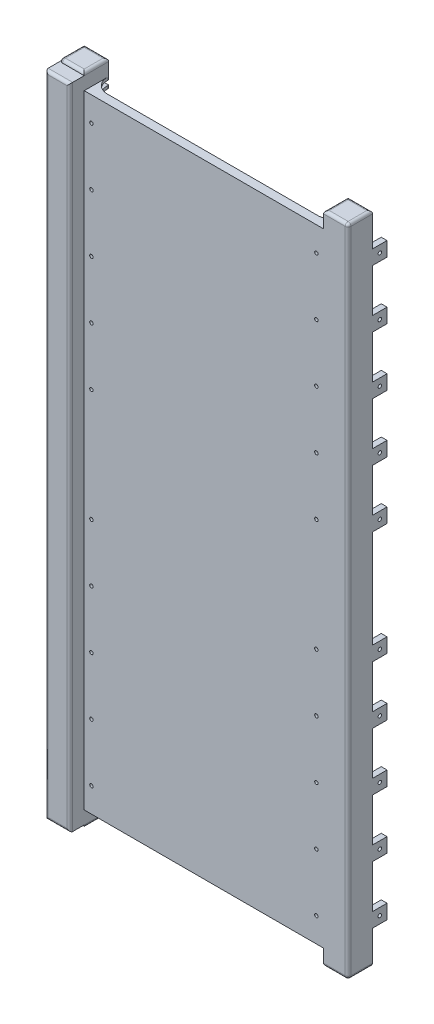
from build123d import *

# Parameters (mm, degrees)
BOSS_EXTRUDE1_DEPTH             = 227
FILLET1_R                       = 1
SKETCH2_W                       = 2
SKETCH2_H                       = 5
BOSS_EXTRUDE2_DEPTH             = 5
BOSS_EXTRUDE6_START             = -41.5
SKETCH13_W                      = 0.2
SKETCH13_H                      = 214
BOSS_EXTRUDE6_DEPTH             = 41.5
F_0_80_TAPPED_HOLE1_AT_2_COUNT  = 2
F_0_80_TAPPED_HOLE1_AT_2_PITCH  = 20
F_0_80_TAPPED_HOLE1_AT_3_COUNT  = 2
F_0_80_TAPPED_HOLE1_AT_3_PITCH  = 40
F_0_80_TAPPED_HOLE1_AT_4_COUNT  = 2
F_0_80_TAPPED_HOLE1_AT_4_PITCH  = 60
F_0_80_TAPPED_HOLE1_AT_5_COUNT  = 2
F_0_80_TAPPED_HOLE1_AT_5_PITCH  = 80
F_0_80_TAPPED_HOLE1_AT_6_COUNT  = 2
F_0_80_TAPPED_HOLE1_AT_6_PITCH  = 119
F_0_80_TAPPED_HOLE1_AT_7_COUNT  = 2
F_0_80_TAPPED_HOLE1_AT_7_PITCH  = 139
F_0_80_TAPPED_HOLE1_AT_8_COUNT  = 2
F_0_80_TAPPED_HOLE1_AT_8_PITCH  = 159
F_0_80_TAPPED_HOLE1_AT_9_COUNT  = 2
F_0_80_TAPPED_HOLE1_AT_9_PITCH  = 179
F_0_80_TAPPED_HOLE1_AT_10_COUNT = 2
F_0_80_TAPPED_HOLE1_AT_10_PITCH = 199
FILLET2_R                       = 2.5
CUT_EXTRUDE1_START              = -6.5
SKETCH3_W                       = 6.5
SKETCH3_H                       = 6.5
CUT_EXTRUDE1_DEPTH              = 214
MIRROR7_COPY_10_SKETCH_W        = 2
MIRROR7_COPY_10_SKETCH_H        = 5
MIRROR7_COPY_10_DEPTH           = 5
FILLET1_OF_MIRROR7_R            = 1
FILLET2_OF_MIRROR7_R            = 2.5
SKETCH14_W                      = 8.5
SKETCH14_H                      = 1
BOSS_EXTRUDE7_DEPTH             = 96
CUT_EXTRUDE2_DEPTH              = 242.486800882
BOSS_EXTRUDE8_DEPTH             = 5
BOSS_EXTRUDE8_DEPTH_BACK        = 1
SKETCH17_W                      = 8.5
SKETCH17_H                      = 225
SKETCH16_W                      = 15
SKETCH16_H                      = 1.55
CUT_EXTRUDE3_DEPTH              = 245.922053927
FILLET3_R                       = 1


with BuildPart() as part:
    # Sketch1 → Boss-Extrude1 (new body)
    with BuildSketch(Plane(origin=(0, 0, 0), x_dir=(1, 0, 0), z_dir=(0, 1, 0))):
        with BuildLine():
            Line((-3.25, -4.25), (4.25, -4.25))
            Line((4.25, -4.25), (4.25, 4.25))
            Line((4.25, 4.25), (-4.25, 4.25))
            Line((-4.25, 4.25), (-4.25, -3.25))
            ThreePointArc((-4.25, -3.25), (-3.957106781, -3.957106781), (-3.25, -4.25))
        make_face()
    boss_extrude1 = extrude(amount=BOSS_EXTRUDE1_DEPTH)

    # Fillet1
    fillet1_edges = [part.edges().sort_by_distance(p)[0] for p in [
        (-4.25, 227, -0.5),
        (-3.957106781, 227, 3.957106781),
        (0.5, 227, 4.25),
        (4.25, 227, 0),
        (0.5, 0, 4.25),
        (-3.957106781, 0, 3.957106781),
        (-4.25, 0, -0.5),
        (0, 0, -4.25),
        (4.25, 0, 0),
        (0, 227, -4.25),
    ]]
    fillet(fillet1_edges, radius=FILLET1_R)

    # Sketch2 → Boss-Extrude2 (add)
    with BuildSketch(Plane(origin=(4.25, 0, 0), x_dir=(0, 0, -1), z_dir=(1, 0, 0))):
        with Locations((-3.25, 213)):
            Rectangle(SKETCH2_W, SKETCH2_H)
        with Locations((-3.25, 193)):
            Rectangle(SKETCH2_W, SKETCH2_H)
        with Locations((-3.25, 173)):
            Rectangle(SKETCH2_W, SKETCH2_H)
        with Locations((-3.25, 153)):
            Rectangle(SKETCH2_W, SKETCH2_H)
        with Locations((-3.25, 133)):
            Rectangle(SKETCH2_W, SKETCH2_H)
        with Locations((-3.25, 94)):
            Rectangle(SKETCH2_W, SKETCH2_H)
        with Locations((-3.25, 74)):
            Rectangle(SKETCH2_W, SKETCH2_H)
        with Locations((-3.25, 54)):
            Rectangle(SKETCH2_W, SKETCH2_H)
        with Locations((-3.25, 34)):
            Rectangle(SKETCH2_W, SKETCH2_H)
        with Locations((-3.25, 14)):
            Rectangle(SKETCH2_W, SKETCH2_H)
    boss_extrude2 = extrude(amount=BOSS_EXTRUDE2_DEPTH)

    # Sketch13 → Boss-Extrude6 (add)
    with BuildSketch(Plane.ZY.offset(-4.25).offset(BOSS_EXTRUDE6_START)):
        with Locations((4.15, 113.5)):
            Rectangle(SKETCH13_W, SKETCH13_H)
    boss_extrude6 = extrude(amount=BOSS_EXTRUDE6_DEPTH)

    # Sketch11 → #0-80 Tapped Hole1 (revolve, cut)
    with BuildSketch(Plane(origin=(6.75, 213, 4.25), x_dir=(0, -1, 0), z_dir=(1, 0, 0))):
        Polygon((0, 0), (0, 4.358390611), (0.59563, 4.0005), (0.59563, 0), align=None)
    f_0_80_tapped_hole1 = revolve(axis=Axis((6.75, 213, 10.6), (0, 0, -1)), mode=Mode.SUBTRACT)

    # #0-80 Tapped Hole1 at 2: #0-80 Tapped Hole1 ×2
    with Locations(*[(0, -i * F_0_80_TAPPED_HOLE1_AT_2_PITCH, 0) for i in range(1, F_0_80_TAPPED_HOLE1_AT_2_COUNT)]):
        add(f_0_80_tapped_hole1, mode=Mode.SUBTRACT)

    # #0-80 Tapped Hole1 at 3: #0-80 Tapped Hole1 ×2
    with Locations(*[(0, -i * F_0_80_TAPPED_HOLE1_AT_3_PITCH, 0) for i in range(1, F_0_80_TAPPED_HOLE1_AT_3_COUNT)]):
        add(f_0_80_tapped_hole1, mode=Mode.SUBTRACT)

    # #0-80 Tapped Hole1 at 4: #0-80 Tapped Hole1 ×2
    with Locations(*[(0, -i * F_0_80_TAPPED_HOLE1_AT_4_PITCH, 0) for i in range(1, F_0_80_TAPPED_HOLE1_AT_4_COUNT)]):
        add(f_0_80_tapped_hole1, mode=Mode.SUBTRACT)

    # #0-80 Tapped Hole1 at 5: #0-80 Tapped Hole1 ×2
    with Locations(*[(0, -i * F_0_80_TAPPED_HOLE1_AT_5_PITCH, 0) for i in range(1, F_0_80_TAPPED_HOLE1_AT_5_COUNT)]):
        add(f_0_80_tapped_hole1, mode=Mode.SUBTRACT)

    # #0-80 Tapped Hole1 at 6: #0-80 Tapped Hole1 ×2
    with Locations(*[(0, -i * F_0_80_TAPPED_HOLE1_AT_6_PITCH, 0) for i in range(1, F_0_80_TAPPED_HOLE1_AT_6_COUNT)]):
        add(f_0_80_tapped_hole1, mode=Mode.SUBTRACT)

    # #0-80 Tapped Hole1 at 7: #0-80 Tapped Hole1 ×2
    with Locations(*[(0, -i * F_0_80_TAPPED_HOLE1_AT_7_PITCH, 0) for i in range(1, F_0_80_TAPPED_HOLE1_AT_7_COUNT)]):
        add(f_0_80_tapped_hole1, mode=Mode.SUBTRACT)

    # #0-80 Tapped Hole1 at 8: #0-80 Tapped Hole1 ×2
    with Locations(*[(0, -i * F_0_80_TAPPED_HOLE1_AT_8_PITCH, 0) for i in range(1, F_0_80_TAPPED_HOLE1_AT_8_COUNT)]):
        add(f_0_80_tapped_hole1, mode=Mode.SUBTRACT)

    # #0-80 Tapped Hole1 at 9: #0-80 Tapped Hole1 ×2
    with Locations(*[(0, -i * F_0_80_TAPPED_HOLE1_AT_9_PITCH, 0) for i in range(1, F_0_80_TAPPED_HOLE1_AT_9_COUNT)]):
        add(f_0_80_tapped_hole1, mode=Mode.SUBTRACT)

    # #0-80 Tapped Hole1 at 10: #0-80 Tapped Hole1 ×2
    with Locations(*[(0, -i * F_0_80_TAPPED_HOLE1_AT_10_PITCH, 0) for i in range(1, F_0_80_TAPPED_HOLE1_AT_10_COUNT)]):
        add(f_0_80_tapped_hole1, mode=Mode.SUBTRACT)

    # Fillet2
    fillet2_edges = [part.edges().sort_by_distance(p)[0] for p in [
        (4.25, 215.5, 3.15),
    ]]
    fillet(fillet2_edges, radius=FILLET2_R)
    fillet2_2_edges = [part.edges().sort_by_distance(p)[0] for p in [
        (4.25, 195.5, 3.15),
    ]]
    fillet(fillet2_2_edges, radius=FILLET2_R)
    fillet2_3_edges = [part.edges().sort_by_distance(p)[0] for p in [
        (4.25, 175.5, 3.15),
    ]]
    fillet(fillet2_3_edges, radius=FILLET2_R)
    fillet2_4_edges = [part.edges().sort_by_distance(p)[0] for p in [
        (4.25, 155.5, 3.15),
    ]]
    fillet(fillet2_4_edges, radius=FILLET2_R)
    fillet2_5_edges = [part.edges().sort_by_distance(p)[0] for p in [
        (4.25, 135.5, 3.15),
    ]]
    fillet(fillet2_5_edges, radius=FILLET2_R)
    fillet2_6_edges = [part.edges().sort_by_distance(p)[0] for p in [
        (4.25, 91.5, 3.15),
    ]]
    fillet(fillet2_6_edges, radius=FILLET2_R)
    fillet2_7_edges = [part.edges().sort_by_distance(p)[0] for p in [
        (4.25, 71.5, 3.15),
    ]]
    fillet(fillet2_7_edges, radius=FILLET2_R)
    fillet2_8_edges = [part.edges().sort_by_distance(p)[0] for p in [
        (4.25, 51.5, 3.15),
    ]]
    fillet(fillet2_8_edges, radius=FILLET2_R)
    fillet2_9_edges = [part.edges().sort_by_distance(p)[0] for p in [
        (4.25, 31.5, 3.15),
    ]]
    fillet(fillet2_9_edges, radius=FILLET2_R)
    fillet2_10_edges = [part.edges().sort_by_distance(p)[0] for p in [
        (4.25, 11.5, 3.15),
    ]]
    fillet(fillet2_10_edges, radius=FILLET2_R)
    fillet2_11_edges = [part.edges().sort_by_distance(p)[0] for p in [
        (9.25, 215.5, 3.15),
    ]]
    fillet(fillet2_11_edges, radius=FILLET2_R - 0.0001)  # a hair under: the kernel refuses the full size
    fillet2_12_edges = [part.edges().sort_by_distance(p)[0] for p in [
        (9.25, 195.5, 3.15),
    ]]
    fillet(fillet2_12_edges, radius=FILLET2_R - 0.0001)  # a hair under: the kernel refuses the full size
    fillet2_13_edges = [part.edges().sort_by_distance(p)[0] for p in [
        (9.25, 175.5, 3.15),
    ]]
    fillet(fillet2_13_edges, radius=FILLET2_R - 0.0001)  # a hair under: the kernel refuses the full size
    fillet2_14_edges = [part.edges().sort_by_distance(p)[0] for p in [
        (9.25, 155.5, 3.15),
    ]]
    fillet(fillet2_14_edges, radius=FILLET2_R - 0.0001)  # a hair under: the kernel refuses the full size
    fillet2_15_edges = [part.edges().sort_by_distance(p)[0] for p in [
        (9.25, 135.5, 3.15),
    ]]
    fillet(fillet2_15_edges, radius=FILLET2_R - 0.0001)  # a hair under: the kernel refuses the full size
    fillet2_16_edges = [part.edges().sort_by_distance(p)[0] for p in [
        (9.25, 91.5, 3.15),
    ]]
    fillet(fillet2_16_edges, radius=FILLET2_R - 0.0001)  # a hair under: the kernel refuses the full size
    fillet2_17_edges = [part.edges().sort_by_distance(p)[0] for p in [
        (9.25, 71.5, 3.15),
    ]]
    fillet(fillet2_17_edges, radius=FILLET2_R - 0.0001)  # a hair under: the kernel refuses the full size
    fillet2_18_edges = [part.edges().sort_by_distance(p)[0] for p in [
        (9.25, 51.5, 3.15),
    ]]
    fillet(fillet2_18_edges, radius=FILLET2_R - 0.0001)  # a hair under: the kernel refuses the full size
    fillet2_19_edges = [part.edges().sort_by_distance(p)[0] for p in [
        (9.25, 31.5, 3.15),
    ]]
    fillet(fillet2_19_edges, radius=FILLET2_R - 0.0001)  # a hair under: the kernel refuses the full size
    fillet2_20_edges = [part.edges().sort_by_distance(p)[0] for p in [
        (9.25, 11.5, 3.15),
    ]]
    fillet(fillet2_20_edges, radius=FILLET2_R - 0.0001)  # a hair under: the kernel refuses the full size

    # Mirror1: Boss-Extrude2, #0-80 Tapped Hole1 across plane
    add(boss_extrude2.mirror(Plane(origin=(0, 0, 0), x_dir=(-0.7071067811865478, 0, 0.7071067811865472), z_dir=(-0.7071067811865475, 0, -0.7071067811865477))))
    add(f_0_80_tapped_hole1.mirror(Plane(origin=(0, 0, 0), x_dir=(-0.7071067811865478, 0, 0.7071067811865472), z_dir=(-0.7071067811865475, 0, -0.7071067811865477))), mode=Mode.SUBTRACT)

    # Mirror1 copy 1 sketch → Mirror1 copy 1 (revolve, cut)
    with BuildSketch(Plane(origin=(-4.25, 193, -6.75), x_dir=(0, -1, 0), z_dir=(0, 0, -1))):
        Polygon((0, 0), (0, -4.358390611), (0.59563, -4.0005), (0.59563, 0), align=None)
    revolve(axis=Axis((-10.6, 193, -6.75), (-1, 0, 0)), mode=Mode.SUBTRACT)

    # Mirror1 copy 2 sketch → Mirror1 copy 2 (revolve, cut)
    with BuildSketch(Plane(origin=(-4.25, 173, -6.75), x_dir=(0, -1, 0), z_dir=(0, 0, -1))):
        Polygon((0, 0), (0, -4.358390611), (0.59563, -4.0005), (0.59563, 0), align=None)
    revolve(axis=Axis((-10.6, 173, -6.75), (-1, 0, 0)), mode=Mode.SUBTRACT)

    # Mirror1 copy 3 sketch → Mirror1 copy 3 (revolve, cut)
    with BuildSketch(Plane(origin=(-4.25, 153, -6.75), x_dir=(0, -1, 0), z_dir=(0, 0, -1))):
        Polygon((0, 0), (0, -4.358390611), (0.59563, -4.0005), (0.59563, 0), align=None)
    revolve(axis=Axis((-10.6, 153, -6.75), (-1, 0, 0)), mode=Mode.SUBTRACT)

    # Mirror1 copy 4 sketch → Mirror1 copy 4 (revolve, cut)
    with BuildSketch(Plane(origin=(-4.25, 133, -6.75), x_dir=(0, -1, 0), z_dir=(0, 0, -1))):
        Polygon((0, 0), (0, -4.358390611), (0.59563, -4.0005), (0.59563, 0), align=None)
    revolve(axis=Axis((-10.6, 133, -6.75), (-1, 0, 0)), mode=Mode.SUBTRACT)

    # Mirror1 copy 5 sketch → Mirror1 copy 5 (revolve, cut)
    with BuildSketch(Plane(origin=(-4.25, 94, -6.75), x_dir=(0, -1, 0), z_dir=(0, 0, -1))):
        Polygon((0, 0), (0, -4.358390611), (0.59563, -4.0005), (0.59563, 0), align=None)
    revolve(axis=Axis((-10.6, 94, -6.75), (-1, 0, 0)), mode=Mode.SUBTRACT)

    # Mirror1 copy 6 sketch → Mirror1 copy 6 (revolve, cut)
    with BuildSketch(Plane(origin=(-4.25, 74, -6.75), x_dir=(0, -1, 0), z_dir=(0, 0, -1))):
        Polygon((0, 0), (0, -4.358390611), (0.59563, -4.0005), (0.59563, 0), align=None)
    revolve(axis=Axis((-10.6, 74, -6.75), (-1, 0, 0)), mode=Mode.SUBTRACT)

    # Mirror1 copy 7 sketch → Mirror1 copy 7 (revolve, cut)
    with BuildSketch(Plane(origin=(-4.25, 54, -6.75), x_dir=(0, -1, 0), z_dir=(0, 0, -1))):
        Polygon((0, 0), (0, -4.358390611), (0.59563, -4.0005), (0.59563, 0), align=None)
    revolve(axis=Axis((-10.6, 54, -6.75), (-1, 0, 0)), mode=Mode.SUBTRACT)

    # Mirror1 copy 8 sketch → Mirror1 copy 8 (revolve, cut)
    with BuildSketch(Plane(origin=(-4.25, 34, -6.75), x_dir=(0, -1, 0), z_dir=(0, 0, -1))):
        Polygon((0, 0), (0, -4.358390611), (0.59563, -4.0005), (0.59563, 0), align=None)
    revolve(axis=Axis((-10.6, 34, -6.75), (-1, 0, 0)), mode=Mode.SUBTRACT)

    # Mirror1 copy 9 sketch → Mirror1 copy 9 (revolve, cut)
    with BuildSketch(Plane(origin=(-4.25, 14, -6.75), x_dir=(0, -1, 0), z_dir=(0, 0, -1))):
        Polygon((0, 0), (0, -4.358390611), (0.59563, -4.0005), (0.59563, 0), align=None)
    revolve(axis=Axis((-10.6, 14, -6.75), (-1, 0, 0)), mode=Mode.SUBTRACT)

    # Sketch3 → Cut-Extrude1 (cut)
    with BuildSketch(Plane(origin=(0, 227, 0), x_dir=(1, 0, 0), z_dir=(0, 1, 0)).offset(CUT_EXTRUDE1_START)):
        with Locations((1, 1)):
            Rectangle(SKETCH3_W, SKETCH3_H)
    cut_extrude1 = extrude(amount=-CUT_EXTRUDE1_DEPTH, mode=Mode.SUBTRACT)

    # Mirror7: Boss-Extrude1, Boss-Extrude2, Boss-Extrude6, #0-80 Tapped Hole1, Cut-Extrude1 across plane
    add(boss_extrude1.mirror(Plane.ZY.offset(-45.75)))
    add(boss_extrude2.mirror(Plane.ZY.offset(-45.75)))
    add(boss_extrude6.mirror(Plane.ZY.offset(-45.75)))
    add(f_0_80_tapped_hole1.mirror(Plane.ZY.offset(-45.75)), mode=Mode.SUBTRACT)
    add(cut_extrude1.mirror(Plane.ZY.offset(-45.75)), mode=Mode.SUBTRACT)

    # Mirror7 copy 1 sketch → Mirror7 copy 1 (revolve, cut)
    with BuildSketch(Plane(origin=(84.75, 193, 4.25), x_dir=(0, -1, 0), z_dir=(-1, 0, 0))):
        Polygon((0, 0), (0, -4.358390611), (0.59563, -4.0005), (0.59563, 0), align=None)
    revolve(axis=Axis((84.75, 193, 10.6), (0, 0, 1)), mode=Mode.SUBTRACT)

    # Mirror7 copy 2 sketch → Mirror7 copy 2 (revolve, cut)
    with BuildSketch(Plane(origin=(84.75, 173, 4.25), x_dir=(0, -1, 0), z_dir=(-1, 0, 0))):
        Polygon((0, 0), (0, -4.358390611), (0.59563, -4.0005), (0.59563, 0), align=None)
    revolve(axis=Axis((84.75, 173, 10.6), (0, 0, 1)), mode=Mode.SUBTRACT)

    # Mirror7 copy 3 sketch → Mirror7 copy 3 (revolve, cut)
    with BuildSketch(Plane(origin=(84.75, 153, 4.25), x_dir=(0, -1, 0), z_dir=(-1, 0, 0))):
        Polygon((0, 0), (0, -4.358390611), (0.59563, -4.0005), (0.59563, 0), align=None)
    revolve(axis=Axis((84.75, 153, 10.6), (0, 0, 1)), mode=Mode.SUBTRACT)

    # Mirror7 copy 4 sketch → Mirror7 copy 4 (revolve, cut)
    with BuildSketch(Plane(origin=(84.75, 133, 4.25), x_dir=(0, -1, 0), z_dir=(-1, 0, 0))):
        Polygon((0, 0), (0, -4.358390611), (0.59563, -4.0005), (0.59563, 0), align=None)
    revolve(axis=Axis((84.75, 133, 10.6), (0, 0, 1)), mode=Mode.SUBTRACT)

    # Mirror7 copy 5 sketch → Mirror7 copy 5 (revolve, cut)
    with BuildSketch(Plane(origin=(84.75, 94, 4.25), x_dir=(0, -1, 0), z_dir=(-1, 0, 0))):
        Polygon((0, 0), (0, -4.358390611), (0.59563, -4.0005), (0.59563, 0), align=None)
    revolve(axis=Axis((84.75, 94, 10.6), (0, 0, 1)), mode=Mode.SUBTRACT)

    # Mirror7 copy 6 sketch → Mirror7 copy 6 (revolve, cut)
    with BuildSketch(Plane(origin=(84.75, 74, 4.25), x_dir=(0, -1, 0), z_dir=(-1, 0, 0))):
        Polygon((0, 0), (0, -4.358390611), (0.59563, -4.0005), (0.59563, 0), align=None)
    revolve(axis=Axis((84.75, 74, 10.6), (0, 0, 1)), mode=Mode.SUBTRACT)

    # Mirror7 copy 7 sketch → Mirror7 copy 7 (revolve, cut)
    with BuildSketch(Plane(origin=(84.75, 54, 4.25), x_dir=(0, -1, 0), z_dir=(-1, 0, 0))):
        Polygon((0, 0), (0, -4.358390611), (0.59563, -4.0005), (0.59563, 0), align=None)
    revolve(axis=Axis((84.75, 54, 10.6), (0, 0, 1)), mode=Mode.SUBTRACT)

    # Mirror7 copy 8 sketch → Mirror7 copy 8 (revolve, cut)
    with BuildSketch(Plane(origin=(84.75, 34, 4.25), x_dir=(0, -1, 0), z_dir=(-1, 0, 0))):
        Polygon((0, 0), (0, -4.358390611), (0.59563, -4.0005), (0.59563, 0), align=None)
    revolve(axis=Axis((84.75, 34, 10.6), (0, 0, 1)), mode=Mode.SUBTRACT)

    # Mirror7 copy 9 sketch → Mirror7 copy 9 (revolve, cut)
    with BuildSketch(Plane(origin=(84.75, 14, 4.25), x_dir=(0, -1, 0), z_dir=(-1, 0, 0))):
        Polygon((0, 0), (0, -4.358390611), (0.59563, -4.0005), (0.59563, 0), align=None)
    revolve(axis=Axis((84.75, 14, 10.6), (0, 0, 1)), mode=Mode.SUBTRACT)

    # Mirror7 copy 10 sketch → Mirror7 copy 10 (add)
    with BuildSketch(Plane(origin=(91.5, 0, -4.25), x_dir=(-1, 0, 0), z_dir=(0, 0, -1))):
        with Locations((-3.25, 213)):
            Rectangle(MIRROR7_COPY_10_SKETCH_W, MIRROR7_COPY_10_SKETCH_H)
        with Locations((-3.25, 193)):
            Rectangle(MIRROR7_COPY_10_SKETCH_W, MIRROR7_COPY_10_SKETCH_H)
        with Locations((-3.25, 173)):
            Rectangle(MIRROR7_COPY_10_SKETCH_W, MIRROR7_COPY_10_SKETCH_H)
        with Locations((-3.25, 153)):
            Rectangle(MIRROR7_COPY_10_SKETCH_W, MIRROR7_COPY_10_SKETCH_H)
        with Locations((-3.25, 133)):
            Rectangle(MIRROR7_COPY_10_SKETCH_W, MIRROR7_COPY_10_SKETCH_H)
        with Locations((-3.25, 94)):
            Rectangle(MIRROR7_COPY_10_SKETCH_W, MIRROR7_COPY_10_SKETCH_H)
        with Locations((-3.25, 74)):
            Rectangle(MIRROR7_COPY_10_SKETCH_W, MIRROR7_COPY_10_SKETCH_H)
        with Locations((-3.25, 54)):
            Rectangle(MIRROR7_COPY_10_SKETCH_W, MIRROR7_COPY_10_SKETCH_H)
        with Locations((-3.25, 34)):
            Rectangle(MIRROR7_COPY_10_SKETCH_W, MIRROR7_COPY_10_SKETCH_H)
        with Locations((-3.25, 14)):
            Rectangle(MIRROR7_COPY_10_SKETCH_W, MIRROR7_COPY_10_SKETCH_H)
    extrude(amount=MIRROR7_COPY_10_DEPTH)

    # Mirror7 copy 11 sketch → Mirror7 copy 11 (revolve, cut)
    with BuildSketch(Plane(origin=(95.75, 213, -6.75), x_dir=(0, -1, 0), z_dir=(0, 0, -1))):
        Polygon((0, 0), (0, 4.358390611), (0.59563, 4.0005), (0.59563, 0), align=None)
    revolve(axis=Axis((102.1, 213, -6.75), (-1, 0, 0)), mode=Mode.SUBTRACT)

    # Mirror7 copy 12 sketch → Mirror7 copy 12 (revolve, cut)
    with BuildSketch(Plane(origin=(95.75, 193, -6.75), x_dir=(0, -1, 0), z_dir=(0, 0, -1))):
        Polygon((0, 0), (0, 4.358390611), (0.59563, 4.0005), (0.59563, 0), align=None)
    revolve(axis=Axis((102.1, 193, -6.75), (-1, 0, 0)), mode=Mode.SUBTRACT)

    # Mirror7 copy 13 sketch → Mirror7 copy 13 (revolve, cut)
    with BuildSketch(Plane(origin=(95.75, 173, -6.75), x_dir=(0, -1, 0), z_dir=(0, 0, -1))):
        Polygon((0, 0), (0, 4.358390611), (0.59563, 4.0005), (0.59563, 0), align=None)
    revolve(axis=Axis((102.1, 173, -6.75), (-1, 0, 0)), mode=Mode.SUBTRACT)

    # Mirror7 copy 14 sketch → Mirror7 copy 14 (revolve, cut)
    with BuildSketch(Plane(origin=(95.75, 153, -6.75), x_dir=(0, -1, 0), z_dir=(0, 0, -1))):
        Polygon((0, 0), (0, 4.358390611), (0.59563, 4.0005), (0.59563, 0), align=None)
    revolve(axis=Axis((102.1, 153, -6.75), (-1, 0, 0)), mode=Mode.SUBTRACT)

    # Mirror7 copy 15 sketch → Mirror7 copy 15 (revolve, cut)
    with BuildSketch(Plane(origin=(95.75, 133, -6.75), x_dir=(0, -1, 0), z_dir=(0, 0, -1))):
        Polygon((0, 0), (0, 4.358390611), (0.59563, 4.0005), (0.59563, 0), align=None)
    revolve(axis=Axis((102.1, 133, -6.75), (-1, 0, 0)), mode=Mode.SUBTRACT)

    # Mirror7 copy 16 sketch → Mirror7 copy 16 (revolve, cut)
    with BuildSketch(Plane(origin=(95.75, 94, -6.75), x_dir=(0, -1, 0), z_dir=(0, 0, -1))):
        Polygon((0, 0), (0, 4.358390611), (0.59563, 4.0005), (0.59563, 0), align=None)
    revolve(axis=Axis((102.1, 94, -6.75), (-1, 0, 0)), mode=Mode.SUBTRACT)

    # Mirror7 copy 17 sketch → Mirror7 copy 17 (revolve, cut)
    with BuildSketch(Plane(origin=(95.75, 74, -6.75), x_dir=(0, -1, 0), z_dir=(0, 0, -1))):
        Polygon((0, 0), (0, 4.358390611), (0.59563, 4.0005), (0.59563, 0), align=None)
    revolve(axis=Axis((102.1, 74, -6.75), (-1, 0, 0)), mode=Mode.SUBTRACT)

    # Mirror7 copy 18 sketch → Mirror7 copy 18 (revolve, cut)
    with BuildSketch(Plane(origin=(95.75, 54, -6.75), x_dir=(0, -1, 0), z_dir=(0, 0, -1))):
        Polygon((0, 0), (0, 4.358390611), (0.59563, 4.0005), (0.59563, 0), align=None)
    revolve(axis=Axis((102.1, 54, -6.75), (-1, 0, 0)), mode=Mode.SUBTRACT)

    # Mirror7 copy 19 sketch → Mirror7 copy 19 (revolve, cut)
    with BuildSketch(Plane(origin=(95.75, 34, -6.75), x_dir=(0, -1, 0), z_dir=(0, 0, -1))):
        Polygon((0, 0), (0, 4.358390611), (0.59563, 4.0005), (0.59563, 0), align=None)
    revolve(axis=Axis((102.1, 34, -6.75), (-1, 0, 0)), mode=Mode.SUBTRACT)

    # Mirror7 copy 20 sketch → Mirror7 copy 20 (revolve, cut)
    with BuildSketch(Plane(origin=(95.75, 14, -6.75), x_dir=(0, -1, 0), z_dir=(0, 0, -1))):
        Polygon((0, 0), (0, 4.358390611), (0.59563, 4.0005), (0.59563, 0), align=None)
    revolve(axis=Axis((102.1, 14, -6.75), (-1, 0, 0)), mode=Mode.SUBTRACT)

    # Fillet1 of Mirror7
    fillet1_of_mirror7_edges = [part.edges().sort_by_distance(p)[0] for p in [
        (95.75, 227, -0.5),
        (95.457106781, 227, 3.957106781),
        (91, 227, 4.25),
        (87.25, 227, 0),
        (91, 0, 4.25),
        (95.457106781, 0, 3.957106781),
        (95.75, 0, -0.5),
        (91.5, 0, -4.25),
        (87.25, 0, 0),
        (91.5, 227, -4.25),
    ]]
    fillet(fillet1_of_mirror7_edges, radius=FILLET1_OF_MIRROR7_R)

    # Fillet2 of Mirror7
    fillet2_of_mirror7_edges = [part.edges().sort_by_distance(p)[0] for p in [
        (87.25, 11.5, 3.15),
    ]]
    fillet(fillet2_of_mirror7_edges, radius=FILLET2_OF_MIRROR7_R)
    fillet2_of_mirror7_2_edges = [part.edges().sort_by_distance(p)[0] for p in [
        (87.25, 215.5, 3.15),
    ]]
    fillet(fillet2_of_mirror7_2_edges, radius=FILLET2_OF_MIRROR7_R)
    fillet2_of_mirror7_3_edges = [part.edges().sort_by_distance(p)[0] for p in [
        (82.25, 11.5, 3.15),
    ]]
    fillet(fillet2_of_mirror7_3_edges, radius=FILLET2_OF_MIRROR7_R - 0.0001)  # a hair under: the kernel refuses the full size
    fillet2_of_mirror7_4_edges = [part.edges().sort_by_distance(p)[0] for p in [
        (82.25, 215.5, 3.15),
    ]]
    fillet(fillet2_of_mirror7_4_edges, radius=FILLET2_OF_MIRROR7_R - 0.0001)  # a hair under: the kernel refuses the full size
    fillet2_of_mirror7_5_edges = [part.edges().sort_by_distance(p)[0] for p in [
        (87.25, 195.5, 3.15),
    ]]
    fillet(fillet2_of_mirror7_5_edges, radius=FILLET2_OF_MIRROR7_R)
    fillet2_of_mirror7_6_edges = [part.edges().sort_by_distance(p)[0] for p in [
        (87.25, 31.5, 3.15),
    ]]
    fillet(fillet2_of_mirror7_6_edges, radius=FILLET2_OF_MIRROR7_R)
    fillet2_of_mirror7_7_edges = [part.edges().sort_by_distance(p)[0] for p in [
        (82.25, 195.5, 3.15),
    ]]
    fillet(fillet2_of_mirror7_7_edges, radius=FILLET2_OF_MIRROR7_R - 0.0001)  # a hair under: the kernel refuses the full size
    fillet2_of_mirror7_8_edges = [part.edges().sort_by_distance(p)[0] for p in [
        (82.25, 31.5, 3.15),
    ]]
    fillet(fillet2_of_mirror7_8_edges, radius=FILLET2_OF_MIRROR7_R - 0.0001)  # a hair under: the kernel refuses the full size
    fillet2_of_mirror7_9_edges = [part.edges().sort_by_distance(p)[0] for p in [
        (87.25, 175.5, 3.15),
    ]]
    fillet(fillet2_of_mirror7_9_edges, radius=FILLET2_OF_MIRROR7_R)
    fillet2_of_mirror7_10_edges = [part.edges().sort_by_distance(p)[0] for p in [
        (87.25, 51.5, 3.15),
    ]]
    fillet(fillet2_of_mirror7_10_edges, radius=FILLET2_OF_MIRROR7_R)
    fillet2_of_mirror7_11_edges = [part.edges().sort_by_distance(p)[0] for p in [
        (82.25, 175.5, 3.15),
    ]]
    fillet(fillet2_of_mirror7_11_edges, radius=FILLET2_OF_MIRROR7_R - 0.0001)  # a hair under: the kernel refuses the full size
    fillet2_of_mirror7_12_edges = [part.edges().sort_by_distance(p)[0] for p in [
        (82.25, 51.5, 3.15),
    ]]
    fillet(fillet2_of_mirror7_12_edges, radius=FILLET2_OF_MIRROR7_R - 0.0001)  # a hair under: the kernel refuses the full size
    fillet2_of_mirror7_13_edges = [part.edges().sort_by_distance(p)[0] for p in [
        (87.25, 155.5, 3.15),
    ]]
    fillet(fillet2_of_mirror7_13_edges, radius=FILLET2_OF_MIRROR7_R)
    fillet2_of_mirror7_14_edges = [part.edges().sort_by_distance(p)[0] for p in [
        (87.25, 71.5, 3.15),
    ]]
    fillet(fillet2_of_mirror7_14_edges, radius=FILLET2_OF_MIRROR7_R)
    fillet2_of_mirror7_15_edges = [part.edges().sort_by_distance(p)[0] for p in [
        (82.25, 155.5, 3.15),
    ]]
    fillet(fillet2_of_mirror7_15_edges, radius=FILLET2_OF_MIRROR7_R - 0.0001)  # a hair under: the kernel refuses the full size
    fillet2_of_mirror7_16_edges = [part.edges().sort_by_distance(p)[0] for p in [
        (82.25, 71.5, 3.15),
    ]]
    fillet(fillet2_of_mirror7_16_edges, radius=FILLET2_OF_MIRROR7_R - 0.0001)  # a hair under: the kernel refuses the full size
    fillet2_of_mirror7_17_edges = [part.edges().sort_by_distance(p)[0] for p in [
        (87.25, 135.5, 3.15),
    ]]
    fillet(fillet2_of_mirror7_17_edges, radius=FILLET2_OF_MIRROR7_R)
    fillet2_of_mirror7_18_edges = [part.edges().sort_by_distance(p)[0] for p in [
        (87.25, 91.5, 3.15),
    ]]
    fillet(fillet2_of_mirror7_18_edges, radius=FILLET2_OF_MIRROR7_R)
    fillet2_of_mirror7_19_edges = [part.edges().sort_by_distance(p)[0] for p in [
        (82.25, 135.5, 3.15),
    ]]
    fillet(fillet2_of_mirror7_19_edges, radius=FILLET2_OF_MIRROR7_R - 0.0001)  # a hair under: the kernel refuses the full size
    fillet2_of_mirror7_20_edges = [part.edges().sort_by_distance(p)[0] for p in [
        (82.25, 91.5, 3.15),
    ]]
    fillet(fillet2_of_mirror7_20_edges, radius=FILLET2_OF_MIRROR7_R - 0.0001)  # a hair under: the kernel refuses the full size

    # Sketch14 → Boss-Extrude7 (add)
    with BuildSketch(Plane(origin=(-2.25, 0, 0), x_dir=(0, 0, -1), z_dir=(1, 0, 0))):
        with Locations((0, 8.55)):
            Rectangle(SKETCH14_W, SKETCH14_H)
        with Locations((0, 18.55)):
            Rectangle(SKETCH14_W, SKETCH14_H)
        with Locations((0, 6)):
            Rectangle(SKETCH14_W, SKETCH14_H)
        with Locations((0, 16)):
            Rectangle(SKETCH14_W, SKETCH14_H)
        with Locations((0, 28.55)):
            Rectangle(SKETCH14_W, SKETCH14_H)
        with Locations((0, 26)):
            Rectangle(SKETCH14_W, SKETCH14_H)
        with Locations((0, 38.55)):
            Rectangle(SKETCH14_W, SKETCH14_H)
        with Locations((0, 36)):
            Rectangle(SKETCH14_W, SKETCH14_H)
        with Locations((0, 48.55)):
            Rectangle(SKETCH14_W, SKETCH14_H)
        with Locations((0, 46)):
            Rectangle(SKETCH14_W, SKETCH14_H)
        with Locations((0, 58.55)):
            Rectangle(SKETCH14_W, SKETCH14_H)
        with Locations((0, 56)):
            Rectangle(SKETCH14_W, SKETCH14_H)
        with Locations((0, 68.55)):
            Rectangle(SKETCH14_W, SKETCH14_H)
        with Locations((0, 66)):
            Rectangle(SKETCH14_W, SKETCH14_H)
        with Locations((0, 78.55)):
            Rectangle(SKETCH14_W, SKETCH14_H)
        with Locations((0, 76)):
            Rectangle(SKETCH14_W, SKETCH14_H)
        with Locations((0, 88.55)):
            Rectangle(SKETCH14_W, SKETCH14_H)
        with Locations((0, 86)):
            Rectangle(SKETCH14_W, SKETCH14_H)
        with Locations((0, 98.55)):
            Rectangle(SKETCH14_W, SKETCH14_H)
        with Locations((0, 96)):
            Rectangle(SKETCH14_W, SKETCH14_H)
        with Locations((0, 108.55)):
            Rectangle(SKETCH14_W, SKETCH14_H)
        with Locations((0, 106)):
            Rectangle(SKETCH14_W, SKETCH14_H)
        with Locations((0, 121)):
            Rectangle(SKETCH14_W, SKETCH14_H)
        with Locations((0, 118.45)):
            Rectangle(SKETCH14_W, SKETCH14_H)
        with Locations((0, 131)):
            Rectangle(SKETCH14_W, SKETCH14_H)
        with Locations((0, 128.45)):
            Rectangle(SKETCH14_W, SKETCH14_H)
        with Locations((0, 141)):
            Rectangle(SKETCH14_W, SKETCH14_H)
        with Locations((0, 138.45)):
            Rectangle(SKETCH14_W, SKETCH14_H)
        with Locations((0, 151)):
            Rectangle(SKETCH14_W, SKETCH14_H)
        with Locations((0, 148.45)):
            Rectangle(SKETCH14_W, SKETCH14_H)
        with Locations((0, 161)):
            Rectangle(SKETCH14_W, SKETCH14_H)
        with Locations((0, 158.45)):
            Rectangle(SKETCH14_W, SKETCH14_H)
        with Locations((0, 171)):
            Rectangle(SKETCH14_W, SKETCH14_H)
        with Locations((0, 168.45)):
            Rectangle(SKETCH14_W, SKETCH14_H)
        with Locations((0, 181)):
            Rectangle(SKETCH14_W, SKETCH14_H)
        with Locations((0, 178.45)):
            Rectangle(SKETCH14_W, SKETCH14_H)
        with Locations((0, 191)):
            Rectangle(SKETCH14_W, SKETCH14_H)
        with Locations((0, 188.45)):
            Rectangle(SKETCH14_W, SKETCH14_H)
        with Locations((0, 201)):
            Rectangle(SKETCH14_W, SKETCH14_H)
        with Locations((0, 198.45)):
            Rectangle(SKETCH14_W, SKETCH14_H)
        with Locations((0, 211)):
            Rectangle(SKETCH14_W, SKETCH14_H)
        with Locations((0, 208.45)):
            Rectangle(SKETCH14_W, SKETCH14_H)
        with Locations((0, 221)):
            Rectangle(SKETCH14_W, SKETCH14_H)
        with Locations((0, 218.45)):
            Rectangle(SKETCH14_W, SKETCH14_H)
    extrude(amount=BOSS_EXTRUDE7_DEPTH)

    # Sketch15 → Cut-Extrude2 (cut, through all)
    with BuildSketch(Plane.XZ.offset(-5.5)):
        with BuildLine():
            Line((4.25, -4.25), (4.25, -3.75))
            ThreePointArc((4.25, -3.75), (5.714466094, -0.214466094), (9.25, 1.25))
            Line((9.25, 1.25), (82.25, 1.25))
            ThreePointArc((82.25, 1.25), (85.785533906, -0.214466094), (87.25, -3.75))
            Line((87.25, -3.75), (87.25, -4.25))
            Line((87.25, -4.25), (4.25, -4.25))
        make_face()
    extrude(amount=-CUT_EXTRUDE2_DEPTH, mode=Mode.SUBTRACT)

    # Sketch17 → Boss-Extrude8 (add, two sides: drawn at the far end of the back side and taken through both)
    with BuildSketch(Plane.XY.offset(4.25).offset(-BOSS_EXTRUDE8_DEPTH_BACK)):
        with Locations((0, 113.5)):
            Rectangle(SKETCH17_W, SKETCH17_H)
    extrude(amount=BOSS_EXTRUDE8_DEPTH + BOSS_EXTRUDE8_DEPTH_BACK)

    # Sketch16 → Cut-Extrude3 (cut, through all)
    with BuildSketch(Plane.ZY.offset(-87.25)):
        with Locations((-3.45, 219.725)):
            Rectangle(SKETCH16_W, SKETCH16_H)
        with Locations((-3.45, 209.725)):
            Rectangle(SKETCH16_W, SKETCH16_H)
        with Locations((-3.45, 199.725)):
            Rectangle(SKETCH16_W, SKETCH16_H)
        with Locations((-3.45, 189.725)):
            Rectangle(SKETCH16_W, SKETCH16_H)
        with Locations((-3.45, 179.725)):
            Rectangle(SKETCH16_W, SKETCH16_H)
        with Locations((-3.45, 169.725)):
            Rectangle(SKETCH16_W, SKETCH16_H)
        with Locations((-3.45, 159.725)):
            Rectangle(SKETCH16_W, SKETCH16_H)
        with Locations((-3.45, 149.725)):
            Rectangle(SKETCH16_W, SKETCH16_H)
        with Locations((-3.45, 139.725)):
            Rectangle(SKETCH16_W, SKETCH16_H)
        with Locations((-3.45, 129.725)):
            Rectangle(SKETCH16_W, SKETCH16_H)
        with Locations((-3.45, 119.725)):
            Rectangle(SKETCH16_W, SKETCH16_H)
        with Locations((-3.45, 107.275)):
            Rectangle(SKETCH16_W, SKETCH16_H)
        with Locations((-3.45, 97.275)):
            Rectangle(SKETCH16_W, SKETCH16_H)
        with Locations((-3.45, 87.275)):
            Rectangle(SKETCH16_W, SKETCH16_H)
        with Locations((-3.45, 77.275)):
            Rectangle(SKETCH16_W, SKETCH16_H)
        with Locations((-3.45, 67.275)):
            Rectangle(SKETCH16_W, SKETCH16_H)
        with Locations((-3.45, 57.275)):
            Rectangle(SKETCH16_W, SKETCH16_H)
        with Locations((-3.45, 47.275)):
            Rectangle(SKETCH16_W, SKETCH16_H)
        with Locations((-3.45, 37.275)):
            Rectangle(SKETCH16_W, SKETCH16_H)
        with Locations((-3.45, 27.275)):
            Rectangle(SKETCH16_W, SKETCH16_H)
        with Locations((-3.45, 17.275)):
            Rectangle(SKETCH16_W, SKETCH16_H)
        with Locations((-3.45, 7.275)):
            Rectangle(SKETCH16_W, SKETCH16_H)
    extrude(amount=CUT_EXTRUDE3_DEPTH, mode=Mode.SUBTRACT)

    # Fillet3
    fillet3_edges = [part.edges().sort_by_distance(p)[0] for p in [
        (-4.25, 113.5, 9.25),
        (0, 1, 9.25),
        (4.25, 113.5, 9.25),
        (0, 226, 9.25),
    ]]
    fillet(fillet3_edges, radius=FILLET3_R)


solid = part.part
